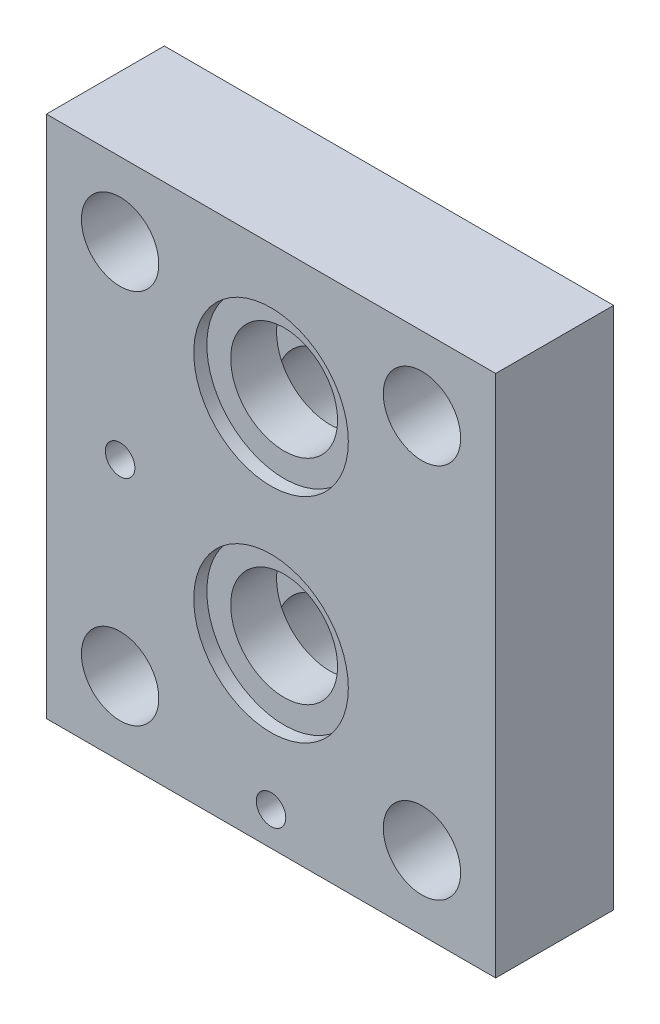
from build123d import *

# Parameters (mm, degrees)
SKETCH1_W                   = 112.776
SKETCH1_H                   = 96.774
BOSS_EXTRUDE1_DEPTH         = 12.7
F_5_8_CLEARANCE_HOLE1_D     = 16.66875
F_5_8_CLEARANCE_HOLE1_DEPTH = 25.4
F_5_8_CLEARANCE_HOLE1_TIP   = 5.007797722
CUT_EXTRUDE2_START          = -12.7
SKETCH4_R                   = 11.509375
CUT_EXTRUDE2_DEPTH          = 12.7
CUT_EXTRUDE4_START          = 12.7
SKETCH5_R                   = 11.509375
CUT_EXTRUDE4_DEPTH          = 12.7
CUT_EXTRUDE6_START          = 12.7
SKETCH6_R                   = 16.6497
CUT_EXTRUDE6_DEPTH          = 2.8194
F_1_4_CLEARANCE_HOLE2_D     = 7.14375
F_1_4_CLEARANCE_HOLE2_DEPTH = 7.874
F_1_4_CLEARANCE_HOLE2_TIP   = 2.146199024
CUT_EXTRUDE8_START          = 12.7
SKETCH11_R                  = 3.175
CUT_EXTRUDE8_DEPTH          = 7.874


with BuildPart() as part:
    # Sketch1 → Boss-Extrude1 (new, symmetric)
    with BuildSketch(Plane(origin=(0, 0, 0), x_dir=(0, 1, 0), z_dir=(0, 0, 1))):
        Rectangle(SKETCH1_W, SKETCH1_H)
    extrude(amount=BOSS_EXTRUDE1_DEPTH, both=True)

    # 5/8 Clearance Hole1
    with Locations(Plane(origin=(0, 0, -12.7), x_dir=(-1, 0, 0), z_dir=(0, 0, -1))):
        with Locations((-32.512, -40.513), (-32.512, 40.513), (32.512, -40.513), (32.512, 40.513)):
            Hole(F_5_8_CLEARANCE_HOLE1_D / 2, depth=F_5_8_CLEARANCE_HOLE1_DEPTH)
            with Locations((0, 0, -(F_5_8_CLEARANCE_HOLE1_DEPTH + F_5_8_CLEARANCE_HOLE1_TIP / 2))):  # 118° drill point
                Cone(0, F_5_8_CLEARANCE_HOLE1_D / 2, F_5_8_CLEARANCE_HOLE1_TIP, mode=Mode.SUBTRACT)

    # Sketch4 → Cut-Extrude2 (cut)
    with BuildSketch(Plane(origin=(0, 0, 0), x_dir=(0, 1, 0), z_dir=(0, 0, 1)).offset(CUT_EXTRUDE2_START)):
        with Locations((-27.813, 0)):
            Circle(SKETCH4_R)
        with Locations((18.161, 0)):
            Circle(SKETCH4_R)
    extrude(amount=CUT_EXTRUDE2_DEPTH, mode=Mode.SUBTRACT)

    # Sketch5 → Cut-Extrude4 (cut)
    with BuildSketch(Plane(origin=(0, 0, 0), x_dir=(0, 1, 0), z_dir=(0, 0, 1)).offset(CUT_EXTRUDE4_START)):
        with Locations((-18.161, 0)):
            Circle(SKETCH5_R)
        with Locations((27.813, 0)):
            Circle(SKETCH5_R)
    extrude(amount=-CUT_EXTRUDE4_DEPTH, mode=Mode.SUBTRACT)

    # Sketch6 → Cut-Extrude6 (cut)
    with BuildSketch(Plane(origin=(0, 0, 0), x_dir=(0, 1, 0), z_dir=(0, 0, 1)).offset(CUT_EXTRUDE6_START)):
        with Locations((-18.161, 0)):
            Circle(SKETCH6_R)
        with Locations((27.813, 0)):
            Circle(SKETCH6_R)
    extrude(amount=-CUT_EXTRUDE6_DEPTH, mode=Mode.SUBTRACT)

    # 1/4 Clearance Hole2
    with Locations(Plane(origin=(0, 0, -12.7), x_dir=(-1, 0, 0), z_dir=(0, 0, -1))):
        with Locations((0, 49.149), (-32.512, 0.127)):
            Hole(F_1_4_CLEARANCE_HOLE2_D / 2, depth=F_1_4_CLEARANCE_HOLE2_DEPTH)
            with Locations((0, 0, -(F_1_4_CLEARANCE_HOLE2_DEPTH + F_1_4_CLEARANCE_HOLE2_TIP / 2))):  # 118° drill point
                Cone(0, F_1_4_CLEARANCE_HOLE2_D / 2, F_1_4_CLEARANCE_HOLE2_TIP, mode=Mode.SUBTRACT)

    # Sketch11 → Cut-Extrude8 (cut)
    with BuildSketch(Plane(origin=(0, 0, 0), x_dir=(0, 1, 0), z_dir=(0, 0, 1)).offset(CUT_EXTRUDE8_START)):
        with Locations((-49.149, 0)):
            Circle(SKETCH11_R)
        with Locations((-0.127, 32.512)):
            Circle(SKETCH11_R)
    extrude(amount=-CUT_EXTRUDE8_DEPTH, mode=Mode.SUBTRACT)


solid = part.part
